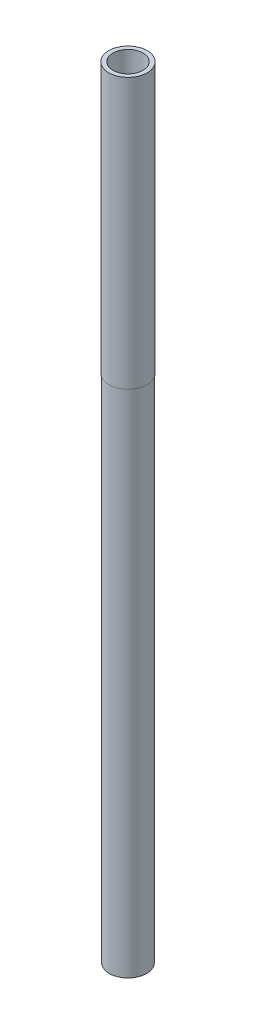
from build123d import *

# Parameters (mm, degrees)
SKETCH1_R           = 0.31
SKETCH1_R_2         = 0.25
BOSS_EXTRUDE1_DEPTH = 13
BOSS_EXTRUDE2_START = -4.5
SKETCH2_R           = 0.32
SKETCH2_R_2         = 0.31
BOSS_EXTRUDE2_DEPTH = 4.5


with BuildPart() as part:
    # Sketch1 → Boss-Extrude1 (new body)
    with BuildSketch(Plane(origin=(0, 0, 0), x_dir=(1, 0, 0), z_dir=(0, 1, 0))):
        Circle(SKETCH1_R)
        Circle(SKETCH1_R_2, mode=Mode.SUBTRACT)
    extrude(amount=BOSS_EXTRUDE1_DEPTH)

    # Sketch2 → Boss-Extrude2 (add)
    with BuildSketch(Plane(origin=(0, 13, 0), x_dir=(1, 0, 0), z_dir=(0, 1, 0)).offset(BOSS_EXTRUDE2_START)):
        Circle(SKETCH2_R)
        Circle(SKETCH2_R_2, mode=Mode.SUBTRACT)
    extrude(amount=BOSS_EXTRUDE2_DEPTH)


solid = part.part
